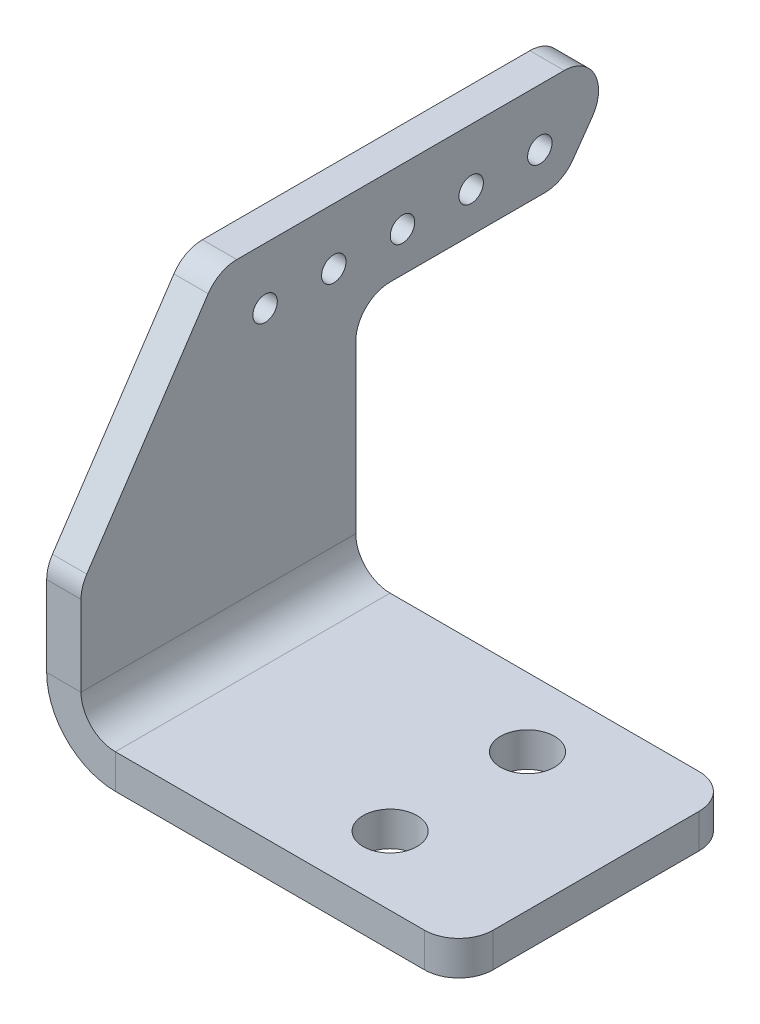
from build123d import *

# Parameters (mm, degrees)
SKETCH1_R                  = 2.4892
BOSS_EXTRUDE1_DEPTH        = 3.175
SKETCHED_START             = -52
SKETCHED_BEND2_DEPTH       = 52
SKETCHED_START_2           = -25.4
SKETCHED_BEND2_2_DEPTH     = 12.7
SKETCHED_START_3           = -41.835294118
SKETCHED_BEND2_3_OUTLINE_W = 3.175
SKETCHED_BEND2_3_OUTLINE_H = 12.7
SKETCHED_BEND2_3_DEPTH     = 16.435294118
SKETCHED_BEND2_4_DEPTH     = 20.459192
SKETCHED_START_4           = -50.8
SKETCHED_BEND2_5_OUTLINE_W = 3.175
SKETCHED_BEND2_5_OUTLINE_H = 12.7
SKETCHED_BEND2_5_DEPTH     = 48.117252
SKETCHED_START_5           = -4.940808
SKETCHED_BEND2_6_DEPTH     = 4.940808
SKETCHED_START_6           = -3.175
SKETCHED_BEND2_7_DEPTH     = 3.175
SKETCH13_R                 = 1.1303
CUT_EXTRUDE2_DEPTH         = 71.302458254
FILLET1_R                  = 3.175
SKETCH14_W                 = 22.407113123
SKETCH14_H                 = 6.985
CUT_EXTRUDE3_DEPTH         = 69.199553227
FILLET2_R                  = 3.175


with BuildPart() as part:
    # Sketch1 → Boss-Extrude1 (new body)
    # profile 1 of 2: a face of its own
    with BuildSketch(Plane(origin=(0, 0, 0), x_dir=(1, 0, 0), z_dir=(0, 1, 0))):
        Polygon((6.35, 0), (25.4, 0), (34.925, 0), (34.925, 25.4), (26.986065751, 25.4), (10.476065751, 25.4), (6.35, 25.4), align=None)
        with Locations(Location((22.225, 6.35, 0), (0, 0, 270))):
            Circle(SKETCH1_R, mode=Mode.SUBTRACT)
        with Locations(Location((22.225, 19.05, 0), (0, 0, 270))):
            Circle(SKETCH1_R, mode=Mode.SUBTRACT)
    # profile 2 of 2: a face of its own
    with BuildSketch(Plane(origin=(0, 0, 0), x_dir=(1, 0, 0), z_dir=(0, 1, 0))):
        Polygon((-12.7, 0), (6.35, 0), (6.35, 25.4), (0, 25.4), (-19.05, 25.4), (-19.05, 41.835294118), (-23.415467049, 44.91680027), (-31.75, 50.8), (-31.75, 12.7), (-23.415467049, 7.143644699), align=None)
    extrude(amount=BOSS_EXTRUDE1_DEPTH)

    # Sketched Bend2: read off the stored shape, not the designer's step
    # Sketched Bend2 outline → Sketched Bend2 (cut)
    with BuildSketch(Plane.XY.offset(SKETCHED_START)):
        with BuildLine():
            ThreePointArc((3.175, 0), (-1e-09, 0.850738686), (-2.324261315, 3.175))
            Line((-2.324261315, 3.175), (-31.75, 3.175))
            Line((-31.75, 3.175), (-31.75, 0))
            Line((-31.75, 0), (3.175, 0))
        make_face()
    extrude(amount=SKETCHED_BEND2_DEPTH, mode=Mode.SUBTRACT)

    # Sketched Bend2 2 outline → Sketched Bend2 2 (add)
    with BuildSketch(Plane.XY.offset(SKETCHED_START_2)):
        with BuildLine():
            ThreePointArc((3.175, 3.175), (0.92993597, 4.10493597), (0, 6.35))
            Line((0, 6.35), (0, 33.794082494))
            Line((0, 33.794082494), (-3.175, 33.794082494))
            Line((-3.175, 33.794082494), (-3.175, 6.35))
            ThreePointArc((-3.175, 6.35), (-2.958628997, 4.706499064), (-2.324261315, 3.175))
            Line((-2.324261315, 3.175), (3.175, 3.175))
        make_face()
    extrude(amount=SKETCHED_BEND2_2_DEPTH)

    # Sketched Bend2 3 outline → Sketched Bend2 3 (add)
    with BuildSketch(Plane.XY.offset(SKETCHED_START_3)):
        with Locations((-1.5875, 27.444082494)):
            Rectangle(SKETCHED_BEND2_3_OUTLINE_W, SKETCHED_BEND2_3_OUTLINE_H)
    extrude(amount=SKETCHED_BEND2_3_DEPTH)

    # Sketched Bend2 4 outline → Sketched Bend2 4 (add)
    with BuildSketch(Plane.XY.offset(SKETCHED_START_2)):
        with BuildLine():
            ThreePointArc((3.175, 3.175), (0.92993597, 4.10493597), (0, 6.35))
            Line((0, 6.35), (0, 21.094082494))
            Line((0, 21.094082494), (-3.175, 21.094082494))
            Line((-3.175, 21.094082494), (-3.175, 6.35))
            ThreePointArc((-3.175, 6.35), (-2.958628997, 4.706499064), (-2.324261315, 3.175))
            Line((-2.324261315, 3.175), (3.175, 3.175))
        make_face()
    extrude(amount=SKETCHED_BEND2_4_DEPTH)

    # Sketched Bend2 5 outline → Sketched Bend2 5 (add)
    with BuildSketch(Plane.XY.offset(SKETCHED_START_4)):
        with Locations((-1.5875, 27.444082494)):
            Rectangle(SKETCHED_BEND2_5_OUTLINE_W, SKETCHED_BEND2_5_OUTLINE_H)
    extrude(amount=SKETCHED_BEND2_5_DEPTH)

    # Sketched Bend2 6 outline → Sketched Bend2 6 (add)
    with BuildSketch(Plane.XY.offset(SKETCHED_START_5)):
        with BuildLine():
            ThreePointArc((3.175, 3.175), (0.92993597, 4.10493597), (0, 6.35))
            Line((0, 6.35), (0, 21.094082494))
            Line((0, 21.094082494), (-3.175, 21.094082494))
            Line((-3.175, 21.094082494), (-3.175, 6.35))
            ThreePointArc((-3.175, 6.35), (-2.958628997, 4.706499064), (-2.324261315, 3.175))
            Line((-2.324261315, 3.175), (3.175, 3.175))
        make_face()
    extrude(amount=SKETCHED_BEND2_6_DEPTH)

    # Sketched Bend2 7 outline → Sketched Bend2 7 (cut)
    with BuildSketch(Plane.YZ.offset(SKETCHED_START_6)):
        Polygon((21.094082494, 0), (14.744082494, 0), (33.794082494, -12.7), (33.794082494, -2.682748), (21.094082494, -2.682748), align=None)
        Polygon((21.094082494, -50.8), (33.794082494, -50.8), (21.094082494, -41.835294118), align=None)
    extrude(amount=SKETCHED_BEND2_7_DEPTH, mode=Mode.SUBTRACT)

    # Sketch13 → Cut-Extrude2 (cut, through all)
    with BuildSketch(Plane(origin=(0, 0, 0), x_dir=(0, 0, -1), z_dir=(1, 0, 0))):
        with Locations(Location((42.418, 28.575, 0), (0, 0, 90))):
            Circle(SKETCH13_R)
        with Locations(Location((36.068, 28.575, 0), (0, 0, 90))):
            Circle(SKETCH13_R)
        with Locations(Location((29.718, 28.575, 0), (0, 0, 90))):
            Circle(SKETCH13_R)
        with Locations(Location((23.368, 28.575, 0), (0, 0, 90))):
            Circle(SKETCH13_R)
        with Locations(Location((17.018, 28.575, 0), (0, 0, 90))):
            Circle(SKETCH13_R)
    extrude(amount=-CUT_EXTRUDE2_DEPTH, mode=Mode.SUBTRACT)

    # Fillet1
    fillet1_edges = [part.edges().sort_by_distance(p)[0] for p in [
        (-1.5875, 21.094082494, -41.835294118),
        (-1.5875, 21.094082494, -25.4),
        (-1.5875, 14.744082494, 0),
        (-1.5875, 33.794082494, -12.7),
        (-1.5875, 33.794082494, -50.8),
        (34.925, 1.5875, -25.4),
        (34.925, 1.5875, 0),
    ]]
    fillet(fillet1_edges, radius=FILLET1_R)

    # Sketch14 → Cut-Extrude3 (cut, through all)
    with BuildSketch(Plane(origin=(0, 0, 0), x_dir=(0, 0, -1), z_dir=(1, 0, 0))):
        with Locations((36.603556561, 21.411582494)):
            Rectangle(SKETCH14_W, SKETCH14_H)
    extrude(amount=-CUT_EXTRUDE3_DEPTH, mode=Mode.SUBTRACT)

    # Fillet2
    fillet2_edges = [part.edges().sort_by_distance(p)[0] for p in [
        (-1.5875, 24.904082494, -44.524705882),
        (-1.5875, 24.904082494, -25.4),
    ]]
    fillet(fillet2_edges, radius=FILLET2_R)


solid = part.part
